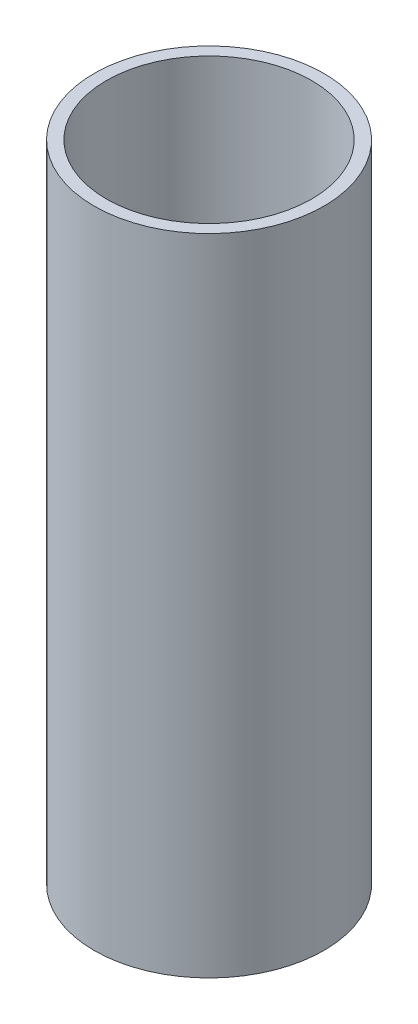
from build123d import *

# Parameters (mm, degrees)
SKETCH1_R           = 50
BOSS_EXTRUDE1_DEPTH = 280.506910522
SKETCH2_R           = 44.664969871
CUT_EXTRUDE1_DEPTH  = 290.282088714


with BuildPart() as part:
    # Sketch1 → Boss-Extrude1 (new body)
    with BuildSketch(Plane(origin=(0, 0, 0), x_dir=(1, 0, 0), z_dir=(0, 1, 0))):
        Circle(SKETCH1_R)
    extrude(amount=BOSS_EXTRUDE1_DEPTH)

    # Sketch2 → Cut-Extrude1 (cut, through all)
    with BuildSketch(Plane(origin=(0, 0, 0), x_dir=(1, 0, 0), z_dir=(0, 1, 0))):
        Circle(SKETCH2_R)
    extrude(amount=CUT_EXTRUDE1_DEPTH, mode=Mode.SUBTRACT)


solid = part.part
